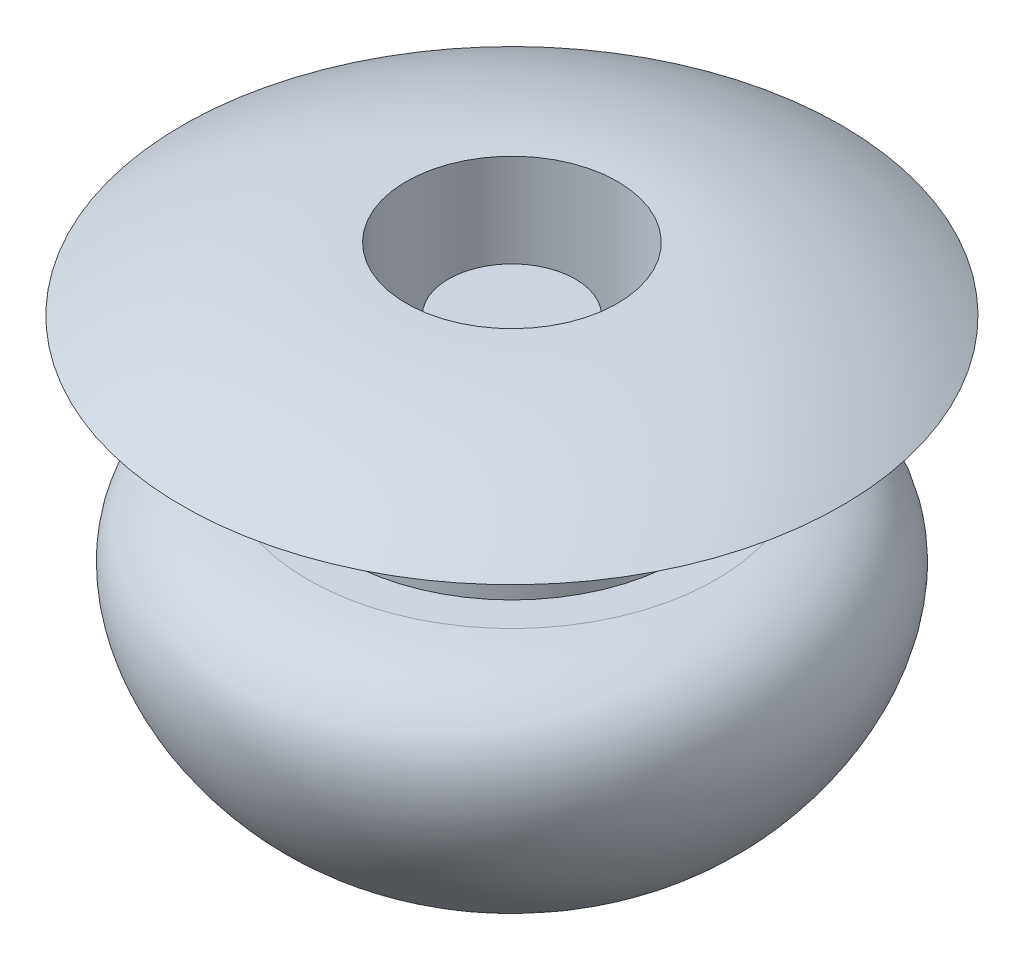
from build123d import *


with BuildPart() as part:
    # Szkic1 → Obrót1 (revolve)
    with BuildSketch(Plane(origin=(0, 0, 0), x_dir=(0, 0, -1), z_dir=(1, 0, 0))):
        with BuildLine():
            Line((0, 0), (-0.75, 0))
            Line((-0.75, 0), (-0.75, -1.700738523))
            Line((-0.75, -1.700738523), (-1.25, -1.700738523))
            Line((-1.25, -1.700738523), (-1.25, 0.75))
            ThreePointArc((-1.25, 0.75), (-2.627043935, 0.558888572), (-3.9, 0))
            Line((-3.9, 0), (-2, 0))
            Line((-2, 0), (-2, -1.5))
            Line((-2, -1.5), (-2.413891755, -1.5))
            add(Edge.make_bspline(
                [(-2.413891755, -1.5), (-3.867503112, -1.669657322), (-3.528877649, -3.802013626), (-1.083961642, -5.373532369), (-0.271752618, -3.374949298), (-0.956030427, -3.078929194)],
                knots=[0, 0, 0, 0, 0.464993082, 0.721927553, 1, 1, 1, 1], degree=3))
            add(Edge.make_bspline(
                [(-0.956030427, -3.078929194), (-0.520263876, -3.200738523), (0, -3.200738523)],
                knots=[0.992852221, 0.992852221, 0.992852221, 1.570796327, 1.570796327, 1.570796327], degree=2, weights=[1, 0.958537313, 1]))
            Line((0, -3.200738523), (0, -1.700738523))
            Line((0, -1.700738523), (0, 0))
        make_face()
    revolve(axis=Axis((0, 0, 0), (0, 1, 0)))


solid = part.part
